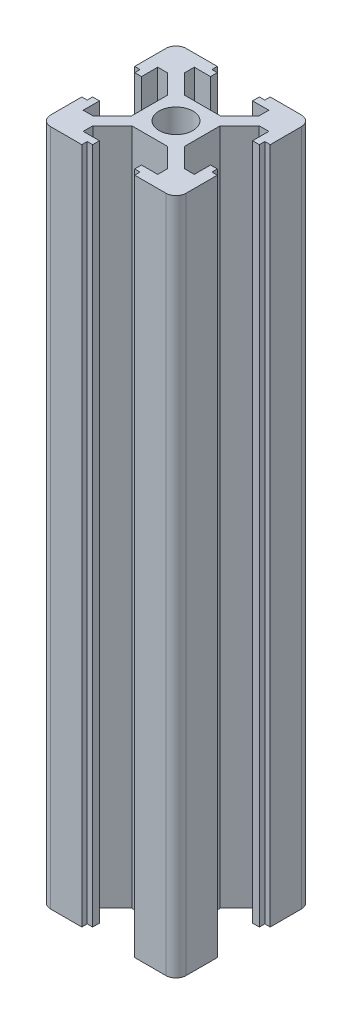
from build123d import *

# Parameters (mm, degrees)
BOSS_EXTRUDE1_DEPTH = 100


with BuildPart() as part:
    # Sketch1 → Boss-Extrude1 (new body)
    with BuildSketch(Plane(origin=(0, 0, 0), x_dir=(1, 0, 0), z_dir=(0, 1, 0))):
        with BuildLine():
            Line((8.5, 10), (3.9, 10))
            Line((3.9, 10), (3.9, 9.2))
            Line((3.9, 9.2), (3.1, 9.2))
            Line((3.1, 9.2), (3.1, 8.2))
            Line((3.1, 8.2), (5.5, 8.2))
            Line((5.5, 8.2), (5.5, 6.77))
            Line((5.5, 6.77), (2.63, 3.9))
            Line((2.63, 3.9), (2.549104946, 3.9))
            Line((2.549104946, 3.9), (0, 3.9))
            Line((0, 3.9), (-2.63, 3.9))
            Line((-2.63, 3.9), (-5.5, 6.77))
            Line((-5.5, 6.77), (-5.5, 8.2))
            Line((-5.5, 8.2), (-3.1, 8.2))
            Line((-3.1, 8.2), (-3.1, 9.2))
            Line((-3.1, 9.2), (-3.9, 9.2))
            Line((-3.9, 9.2), (-3.9, 10))
            Line((-3.9, 10), (-8.5, 10))
            ThreePointArc((-8.5, 10), (-9.560660172, 9.560660172), (-10, 8.5))
            Line((-10, 8.5), (-10, 3.9))
            Line((-10, 3.9), (-9.2, 3.9))
            Line((-9.2, 3.9), (-9.2, 3.1))
            Line((-9.2, 3.1), (-8.2, 3.1))
            Line((-8.2, 3.1), (-8.2, 5.5))
            Line((-8.2, 5.5), (-6.77, 5.5))
            Line((-6.77, 5.5), (-3.9, 2.63))
            Line((-3.9, 2.63), (-3.9, 0))
            Line((-3.9, 0), (-3.9, -2.63))
            Line((-3.9, -2.63), (-6.77, -5.5))
            Line((-6.77, -5.5), (-8.2, -5.5))
            Line((-8.2, -5.5), (-8.2, -3.1))
            Line((-8.2, -3.1), (-9.2, -3.1))
            Line((-9.2, -3.1), (-9.2, -3.9))
            Line((-9.2, -3.9), (-10, -3.9))
            Line((-10, -3.9), (-10, -8.5))
            ThreePointArc((-10, -8.5), (-9.560660172, -9.560660172), (-8.5, -10))
            Line((-8.5, -10), (-3.9, -10))
            Line((-3.9, -10), (-3.9, -9.2))
            Line((-3.9, -9.2), (-3.1, -9.2))
            Line((-3.1, -9.2), (-3.1, -8.2))
            Line((-3.1, -8.2), (-5.5, -8.2))
            Line((-5.5, -8.2), (-5.5, -6.77))
            Line((-5.5, -6.77), (-2.63, -3.9))
            Line((-2.63, -3.9), (0, -3.9))
            Line((0, -3.9), (2.63, -3.9))
            Line((2.63, -3.9), (5.5, -6.77))
            Line((5.5, -6.77), (5.5, -8.2))
            Line((5.5, -8.2), (3.1, -8.2))
            Line((3.1, -8.2), (3.1, -9.2))
            Line((3.1, -9.2), (3.9, -9.2))
            Line((3.9, -9.2), (3.9, -10))
            Line((3.9, -10), (8.5, -10))
            ThreePointArc((8.5, -10), (9.560660172, -9.560660172), (10, -8.5))
            Line((10, -8.5), (10, -3.9))
            Line((10, -3.9), (9.2, -3.9))
            Line((9.2, -3.9), (9.2, -3.1))
            Line((9.2, -3.1), (8.2, -3.1))
            Line((8.2, -3.1), (8.2, -5.5))
            Line((8.2, -5.5), (6.77, -5.5))
            Line((6.77, -5.5), (3.9, -2.63))
            Line((3.9, -2.63), (3.9, 0))
            Line((3.9, 0), (3.9, 2.63))
            Line((3.9, 2.63), (6.77, 5.5))
            Line((6.77, 5.5), (8.2, 5.5))
            Line((8.2, 5.5), (8.2, 3.1))
            Line((8.2, 3.1), (9.2, 3.1))
            Line((9.2, 3.1), (9.2, 3.9))
            Line((9.2, 3.9), (10, 3.9))
            Line((10, 3.9), (10, 8.5))
            ThreePointArc((10, 8.5), (9.560660172, 9.560660172), (8.5, 10))
        make_face()
        with BuildLine():
            ThreePointArc((0, 2.5), (1.767766953, 1.767766953), (2.5, 0))
            ThreePointArc((2.5, 0), (-1.767766953, -1.767766953), (0, 2.5))
        make_face(mode=Mode.SUBTRACT)
    extrude(amount=BOSS_EXTRUDE1_DEPTH)


solid = part.part
